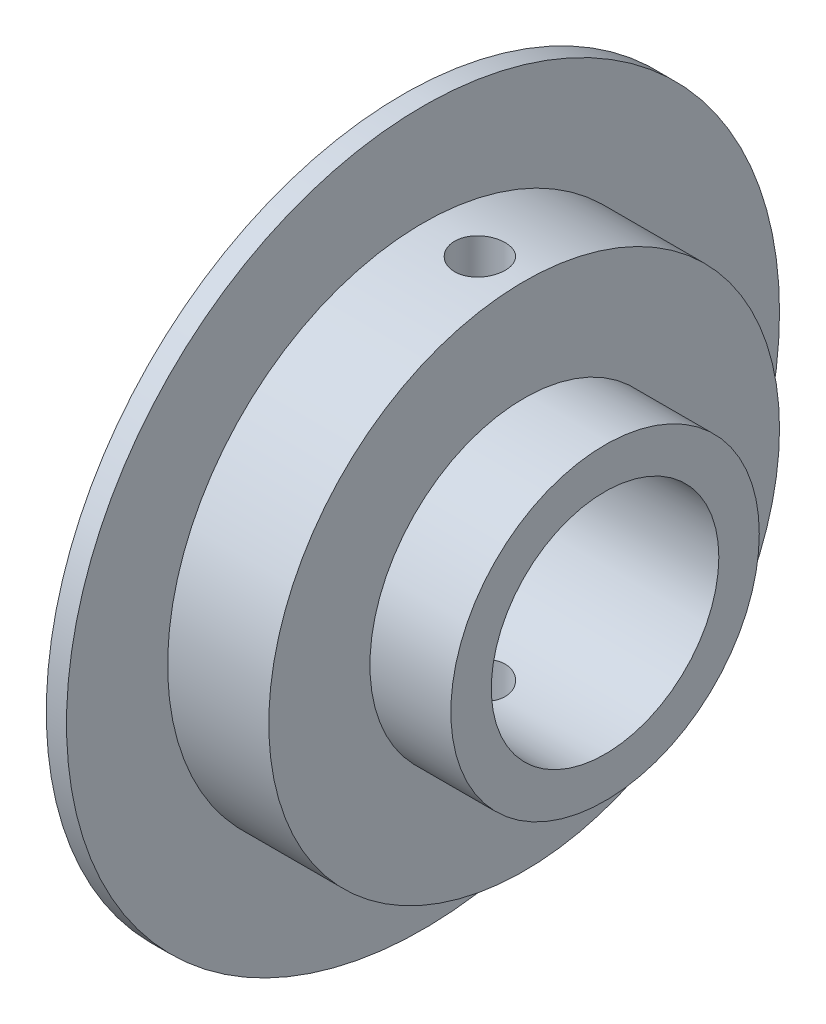
from build123d import *

# Parameters (mm, degrees)
CUT_EXTRUDE1_DEPTH      = 22.485343842
CUT_EXTRUDE1_DEPTH_BACK = 22.485343842
SKETCH4_R               = 1


with BuildPart() as part:
    # Sketch1 → Revolve1 (revolve)
    with BuildSketch(Plane.XY):
        Polygon((0, 0), (8, 0), (8, 1.6), (4.8, 1.6), (4.8, 5.6), (0.8, 5.6), (0.8, 9.6), (0, 9.6), align=None)
    revolve(axis=Axis((124.631559107, -4.5, 0), (-1, 0, 0)))

    # Sketch4 → Cut-Extrude1 (cut, two sides: drawn at the far end of the back side and taken through both)
    with BuildSketch(Plane(origin=(0, -4.5, 0), x_dir=(1, 0, 0), z_dir=(0, 1, 0)).offset(-CUT_EXTRUDE1_DEPTH_BACK)):
        with Locations((3.05, 0)):
            Circle(SKETCH4_R)
    extrude(amount=CUT_EXTRUDE1_DEPTH + CUT_EXTRUDE1_DEPTH_BACK, mode=Mode.SUBTRACT)


solid = part.part
